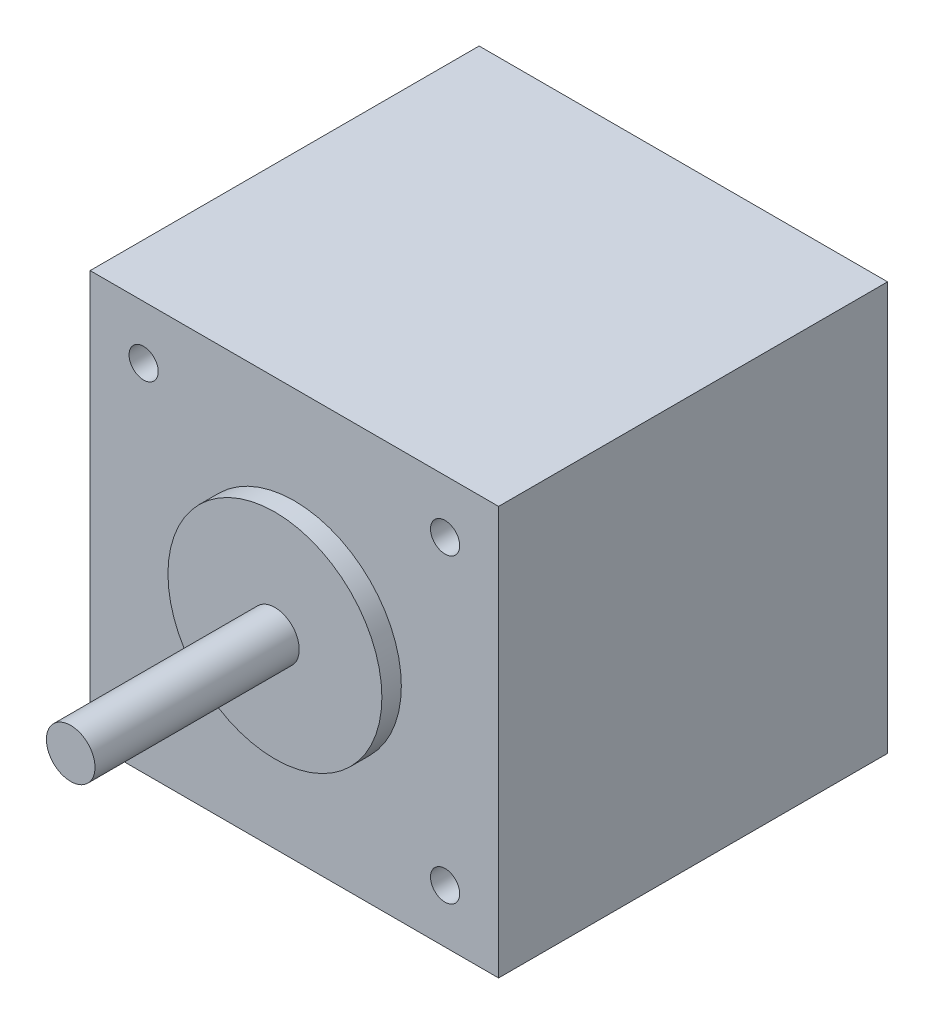
from build123d import *

# Parameters (mm, degrees)
SKETCH_1_W          = 42
SKETCH_1_H          = 42
EXTRUDE_1274_DEPTH  = 40
SKETCH_2_R          = 2.5
EXTRUDE_1329_DEPTH  = 63
SKETCH_3_R          = 11
EXTRUDE_1376_DEPTH  = 42
CUT_EXTRUDE_START   = 40
SKETCH_4_R          = 1.5
CUT_EXTRUDE_3_DEPTH = 4.5


with BuildPart() as part:
    # Эскиз1 → Extrude 1274 (new body)
    with BuildSketch(Plane.XY):
        Rectangle(SKETCH_1_W, SKETCH_1_H)
    extrude(amount=EXTRUDE_1274_DEPTH)

    # Эскиз2 → Extrude 1329 (add)
    with BuildSketch(Plane.XY):
        Circle(SKETCH_2_R)
    extrude(amount=EXTRUDE_1329_DEPTH)

    # Эскиз3 → Extrude 1376 (add)
    with BuildSketch(Plane.XY):
        Circle(SKETCH_3_R)
    extrude(amount=EXTRUDE_1376_DEPTH)

    # Эскиз4 → Крепеж_М3_ПРЕДВ (cut)
    with BuildSketch(Plane.XY.offset(CUT_EXTRUDE_START)):
        with Locations((-15.5, -15.5)):
            Circle(SKETCH_4_R)
        with Locations((-15.5, 15.5)):
            Circle(SKETCH_4_R)
        with Locations((15.5, -15.5)):
            Circle(SKETCH_4_R)
        with Locations((15.5, 15.5)):
            Circle(SKETCH_4_R)
    extrude(amount=-CUT_EXTRUDE_3_DEPTH, mode=Mode.SUBTRACT)


solid = part.part
